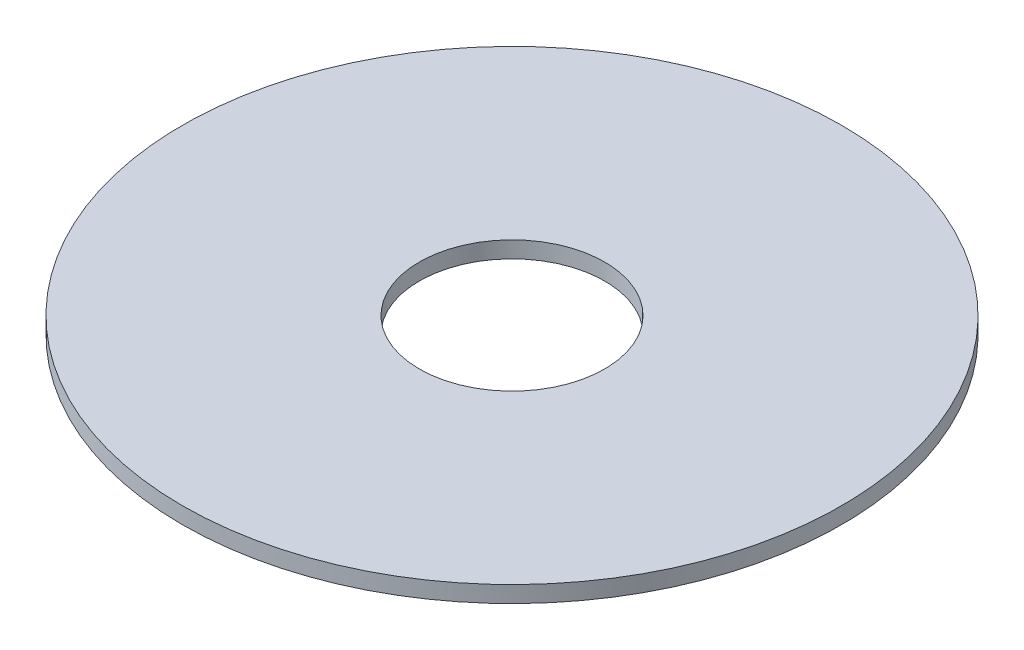
from build123d import *

# Parameters (mm, degrees)
SKETCH1_R           = 80
BOSS_EXTRUDE1_DEPTH = 4
SKETCH2_R           = 22.5
CUT_EXTRUDE1_DEPTH  = 114.207773585


with BuildPart() as part:
    # Sketch1 → Boss-Extrude1 (new body)
    with BuildSketch(Plane(origin=(0, 0, 0), x_dir=(1, 0, 0), z_dir=(0, 1, 0))):
        Circle(SKETCH1_R)
    extrude(amount=BOSS_EXTRUDE1_DEPTH)

    # Sketch2 → Cut-Extrude1 (cut, through all)
    with BuildSketch(Plane(origin=(0, 0, 0), x_dir=(1, 0, 0), z_dir=(0, 1, 0))):
        Circle(SKETCH2_R)
    extrude(amount=CUT_EXTRUDE1_DEPTH, mode=Mode.SUBTRACT)


solid = part.part
